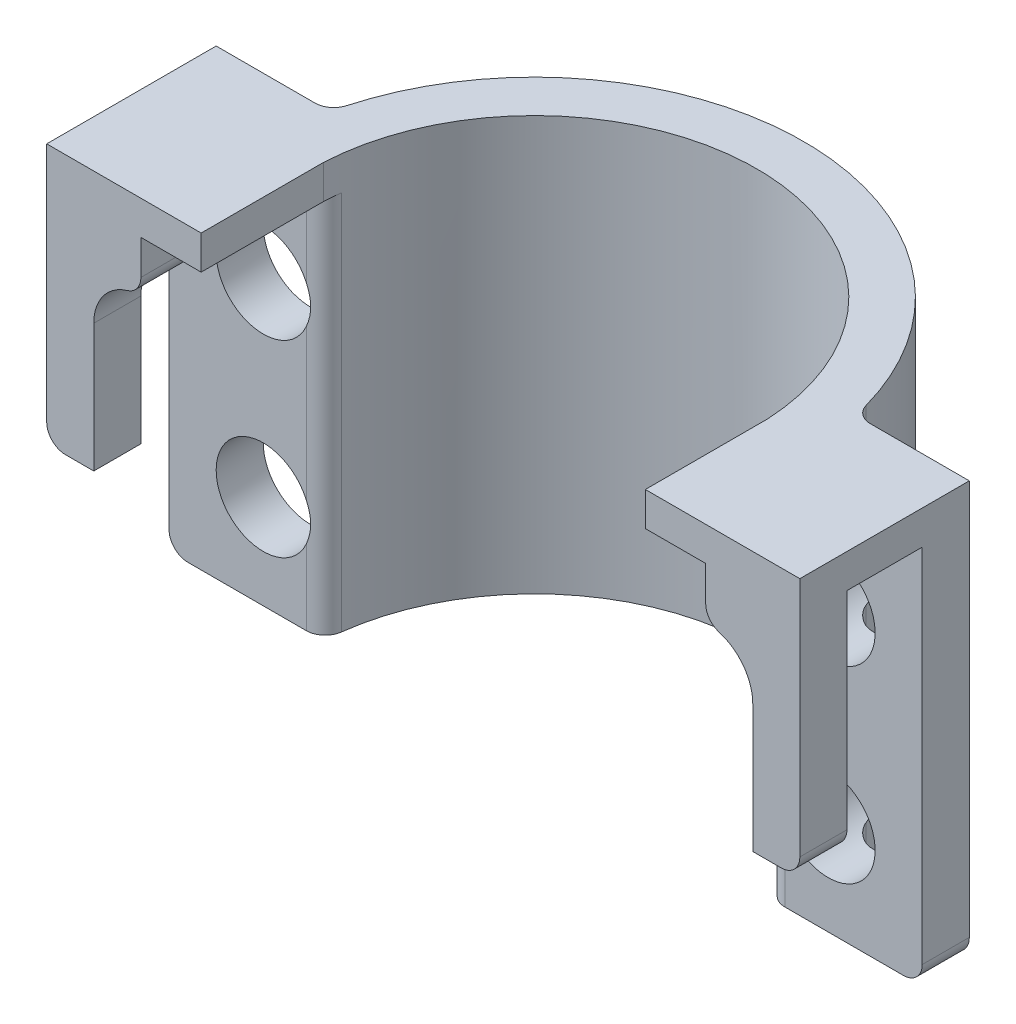
from build123d import *
from OCP.BRepAlgoAPI import BRepAlgoAPI_Cut
from OCP.TopTools import TopTools_ListOfShape

# Parameters (mm, degrees)
BOSS_EXTRUDE1_DEPTH = 27.94
SKETCH3_R           = 3.175
CUT_EXTRUDE1_DEPTH  = 53.100399864
BOSS_EXTRUDE2_START = -10.419367
BOSS_EXTRUDE2_DEPTH = 10.419367
CUT_EXTRUDE2_DEPTH  = 6.35
FILLET1_R           = 1.27


with BuildPart() as part:
    # Sketch2 → Boss-Extrude1 (new body)
    with BuildSketch(Plane(origin=(0, 0, 0), x_dir=(1, 0, 0), z_dir=(0, 1, 0))):
        with BuildLine():
            Line((0, 0), (-10.419367303, 0))
            Line((-10.419367303, 0), (-10.419367303, 3.175))
            Line((-10.419367303, 3.175), (-2.762835284, 3.175))
            ThreePointArc((-2.762835284, 3.175), (14.980632697, 17.413), (32.724100678, 3.175))
            Line((32.724100678, 3.175), (40.380632697, 3.175))
            Line((40.380632697, 3.175), (40.380632697, 0))
            Line((40.380632697, 0), (29.961265394, 0))
            ThreePointArc((29.961265394, 0), (14.980632697, 14.238), (0, 0))
        make_face()
    extrude(amount=-BOSS_EXTRUDE1_DEPTH)

    # Sketch3 → Cut-Extrude1 (cut, through all)
    with BuildSketch(Plane.XY):
        with Locations((-4.069367303, -8.89)):
            Circle(SKETCH3_R)
        with Locations((34.030632697, -8.89)):
            Circle(SKETCH3_R)
        with Locations((-4.069367303, -21.59)):
            Circle(SKETCH3_R)
        with Locations((34.030632697, -21.59)):
            Circle(SKETCH3_R)
    extrude(amount=-CUT_EXTRUDE1_DEPTH, mode=Mode.SUBTRACT)

    # Sketch4 → Boss-Extrude2 (add)
    with BuildSketch(Plane(origin=(40.380632697, 0, 0), x_dir=(0, 0, -1), z_dir=(1, 0, 0)).offset(BOSS_EXTRUDE2_START)):
        Polygon((-5.08, -17.526), (-8.255, -17.526), (-8.255, 0), (0, 0), (0, -2.286), (-5.08, -2.286), align=None)
    boss_extrude2 = extrude(amount=BOSS_EXTRUDE2_DEPTH)


with BuildPart() as cut_extrude2_tool:
    # Sketch5 → Cut-Extrude2 (new body)
    with BuildSketch(Plane.XY.offset(8.255)):
        with BuildLine():
            Line((37.205632697, -8.89), (37.205632697, -17.526))
            Line((37.205632697, -17.526), (29.961265394, -17.526))
            Line((29.961265394, -17.526), (29.961265394, -2.286))
            Line((29.961265394, -2.286), (34.030632697, -2.286))
            Line((34.030632697, -2.286), (34.030632697, -5.715))
            ThreePointArc((34.030632697, -5.715), (36.275696727, -6.64493597), (37.205632697, -8.89))
        make_face()
    cut_extrude2 = extrude(amount=-CUT_EXTRUDE2_DEPTH)


with BuildPart() as part_1:
    add(part.part)

    # Cut-Extrude2: cut by cut_extrude2_tool, with a tolerance
    cut_extrude2_stock = TopTools_ListOfShape()
    cut_extrude2_stock.Append(part_1.part.wrapped)
    cut_extrude2_tools = TopTools_ListOfShape()
    cut_extrude2_tools.Append(cut_extrude2_tool.part.wrapped)
    cut_extrude2_cut = BRepAlgoAPI_Cut()
    cut_extrude2_cut.SetArguments(cut_extrude2_stock)
    cut_extrude2_cut.SetTools(cut_extrude2_tools)
    cut_extrude2_cut.SetFuzzyValue(0.00001)
    cut_extrude2_cut.Build()
    add(Compound.cast(cut_extrude2_cut.Shape()).solids(), mode=Mode.REPLACE)

    # Mirror1: Boss-Extrude2, Cut-Extrude2 across plane
    add(boss_extrude2.mirror(Plane.ZY.offset(-14.980632697)))
    add(cut_extrude2.mirror(Plane.ZY.offset(-14.980632697)), mode=Mode.SUBTRACT)

    # Fillet1
    # the kernel refuses this fillet: 1.27 mm, written as the material it adds along each edge
    with BuildSketch(Plane(origin=(32.724100678, 0, -3.175), x_dir=(1, 0, 0), z_dir=(0, -1, 0))) as fillet1_piece_1_section:
        with BuildLine():
            CenterArc((0.991397271, -1.27), FILLET1_R, 90, 74.467738735)
            ThreePointArc((-0.232222111, -0.929918231), (-0.109979978, -0.466490187), (0, 0))
            Line((0, 0), (0.991397271, 0))
        make_face()
    fillet1_piece_1 = extrude(amount=8.474776002, mode=Mode.PRIVATE)
    fillet1_piece_1 = fillet1_piece_1 - Plane(origin=(34.030632697, -8.89, -3.175), x_dir=(1, 0, 0), z_dir=(0, 0, 1)) * Cylinder(3.175, 21, mode=Mode.PRIVATE)
    add(fillet1_piece_1)
    with BuildSketch(Plane(origin=(32.724100678, -22.005223998, -3.175), x_dir=(1, 0, 0), z_dir=(0, -1, 0))) as fillet1_piece_2_section:
        with BuildLine():
            CenterArc((0.991397271, -1.27), FILLET1_R, 90, 74.467738735)
            ThreePointArc((-0.232222111, -0.929918231), (-0.109979978, -0.466490187), (0, 0))
            Line((0, 0), (0.991397271, 0))
        make_face()
    fillet1_piece_2 = extrude(amount=5.934776002, mode=Mode.PRIVATE)
    fillet1_piece_2 = fillet1_piece_2 - Plane(origin=(34.030632697, -21.59, -3.175), x_dir=(1, 0, 0), z_dir=(0, 0, 1)) * Cylinder(3.175, 16, mode=Mode.PRIVATE)
    add(fillet1_piece_2)
    with BuildSketch(Plane(origin=(32.724100678, -9.305223998, -3.175), x_dir=(1, 0, 0), z_dir=(0, -1, 0))) as fillet1_piece_3_section:
        with BuildLine():
            CenterArc((0.991397271, -1.27), FILLET1_R, 90, 74.467738735)
            ThreePointArc((-0.232222111, -0.929918231), (-0.109979978, -0.466490187), (0, 0))
            Line((0, 0), (0.991397271, 0))
        make_face()
    fillet1_piece_3 = extrude(amount=11.869552004, mode=Mode.PRIVATE)
    fillet1_piece_3 = fillet1_piece_3 - Plane(origin=(34.030632697, -21.59, -3.175), x_dir=(1, 0, 0), z_dir=(0, 0, 1)) * Cylinder(3.175, 28, mode=Mode.PRIVATE)
    fillet1_piece_3 = fillet1_piece_3 - Plane(origin=(34.030632697, -8.89, -3.175), x_dir=(1, 0, 0), z_dir=(0, 0, 1)) * Cylinder(3.175, 28, mode=Mode.PRIVATE)
    add(fillet1_piece_3)
    with BuildSketch(Plane(origin=(-2.762835284, 0, -3.175), x_dir=(0.24228281636804117, 0, -0.9702056673163532), z_dir=(0, -1, 0))) as fillet1_piece_4_section:
        with BuildLine():
            CenterArc((0.991962675, -1.269558427), FILLET1_R, 91.510947972, 74.467738735)
            Line((-0.240198523, -0.96185925), (0, 0))
            ThreePointArc((0, 0), (0.479237682, -0.006319359), (0.958475365, 0))
        make_face()
    fillet1_piece_4 = extrude(amount=8.474776002, mode=Mode.PRIVATE)
    fillet1_piece_4 = fillet1_piece_4 - Plane(origin=(-4.069367303, -8.89, -3.175), x_dir=(1, 0, 0), z_dir=(0, 0, 1)) * Cylinder(3.175, 21, mode=Mode.PRIVATE)
    add(fillet1_piece_4)
    with BuildSketch(Plane(origin=(-2.762835284, -22.005223998, -3.175), x_dir=(0.24228281636804117, 0, -0.9702056673163532), z_dir=(0, -1, 0))) as fillet1_piece_5_section:
        with BuildLine():
            CenterArc((0.991962675, -1.269558427), FILLET1_R, 91.510947972, 74.467738735)
            Line((-0.240198523, -0.96185925), (0, 0))
            ThreePointArc((0, 0), (0.479237682, -0.006319359), (0.958475365, 0))
        make_face()
    fillet1_piece_5 = extrude(amount=5.934776002, mode=Mode.PRIVATE)
    fillet1_piece_5 = fillet1_piece_5 - Plane(origin=(-4.069367303, -21.59, -3.175), x_dir=(1, 0, 0), z_dir=(0, 0, 1)) * Cylinder(3.175, 16, mode=Mode.PRIVATE)
    add(fillet1_piece_5)
    with BuildSketch(Plane(origin=(-2.762835284, -9.305223998, -3.175), x_dir=(0.24228281636804117, 0, -0.9702056673163532), z_dir=(0, -1, 0))) as fillet1_piece_6_section:
        with BuildLine():
            CenterArc((0.991962675, -1.269558427), FILLET1_R, 91.510947972, 74.467738735)
            Line((-0.240198523, -0.96185925), (0, 0))
            ThreePointArc((0, 0), (0.479237682, -0.006319359), (0.958475365, 0))
        make_face()
    fillet1_piece_6 = extrude(amount=11.869552004, mode=Mode.PRIVATE)
    fillet1_piece_6 = fillet1_piece_6 - Plane(origin=(-4.069367303, -21.59, -3.175), x_dir=(1, 0, 0), z_dir=(0, 0, 1)) * Cylinder(3.175, 28, mode=Mode.PRIVATE)
    fillet1_piece_6 = fillet1_piece_6 - Plane(origin=(-4.069367303, -8.89, -3.175), x_dir=(1, 0, 0), z_dir=(0, 0, 1)) * Cylinder(3.175, 28, mode=Mode.PRIVATE)
    add(fillet1_piece_6)
    # the kernel refuses this fillet: 1.27 mm, written as the material it takes off along each edge
    with BuildSketch(Plane(origin=(29.961265394, 2.904944682, 0), x_dir=(-0.08790703364756058, 0, -0.9961286831706467), z_dir=(0, -1, 0))) as fillet1_2_piece_1_section:
        with BuildLine():
            CenterArc((1.1629374, 1.269121421), FILLET1_R, 185.043211655, 82.825455624)
            Line((-0.102146028, 1.157479488), (0, 0))
            ThreePointArc((0, 0), (0.557852926, 0.010376919), (1.115705852, 0))
        make_face()
    fillet1_2_piece_1 = extrude(amount=33.749889363, mode=Mode.PRIVATE)
    fillet1_2_piece_1 = split(fillet1_2_piece_1, bisect_by=Plane(origin=(29.961265394, -2.286, 0), z_dir=(0, -1, 0)), keep=Keep.TOP, mode=Mode.PRIVATE)
    add(fillet1_2_piece_1, mode=Mode.SUBTRACT)
    with BuildSketch(Plane(origin=(0, 2.904944682, 0), x_dir=(-1, 0, 0), z_dir=(0, -1, 0))) as fillet1_2_piece_2_section:
        with BuildLine():
            CenterArc((1.161977873, 1.27), FILLET1_R, 187.174544376, 82.825455624)
            ThreePointArc((-0.098078392, 1.111386601), (-0.038702449, 0.556605505), (0, 0))
            Line((0, 0), (1.161977873, 0))
        make_face()
    fillet1_2_piece_2 = extrude(amount=33.749889363, mode=Mode.PRIVATE)
    fillet1_2_piece_2 = split(fillet1_2_piece_2, bisect_by=Plane(origin=(0, -2.286, 0), z_dir=(0, -1, 0)), keep=Keep.TOP, mode=Mode.PRIVATE)
    add(fillet1_2_piece_2, mode=Mode.SUBTRACT)
    with BuildSketch(Plane(origin=(-10.419367303, -17.526, 1.905), x_dir=(0, 1, 0), z_dir=(0, 0, 1)), Plane(origin=(40.380632697, -27.94, -6.35), x_dir=(-1, 0, 0), z_dir=(0, 0, 1)), Plane(origin=(40.380632697, -17.526, 1.905), x_dir=(-1, 0, 0), z_dir=(0, 0, 1))) as fillet1_2_piece_3:
        with BuildLine():
            CenterArc((FILLET1_R, -FILLET1_R), FILLET1_R, 90, 90)
            Line((0, -FILLET1_R), (0, 0))
            Line((0, 0), (FILLET1_R, 0))
        make_face()
    extrude(amount=9.525, mode=Mode.SUBTRACT)
    with BuildSketch(Plane(origin=(-10.419367303, -27.94, 3.175), x_dir=(0, 1, 0), z_dir=(0, 0, -1))) as fillet1_2_piece_4:
        with BuildLine():
            CenterArc((FILLET1_R, FILLET1_R), FILLET1_R, 180, 90)
            Line((0, FILLET1_R), (0, 0))
            Line((0, 0), (FILLET1_R, 0))
        make_face()
    extrude(amount=9.525, mode=Mode.SUBTRACT)
    with BuildSketch(Plane(origin=(34.030632697, -5.715, 10.966773743), x_dir=(0, 1, 0), z_dir=(0, 0, -1))) as fillet1_2_piece_5:
        with BuildLine():
            CenterArc((1.084709497, 1.27), FILLET1_R, 196.601549599, 73.398450401)
            ThreePointArc((-0.132350359, 0.907142857), (-0.033261818, 0.458373423), (0, 0))
            Line((0, 0), (1.084709497, 0))
        make_face()
    extrude(amount=8.598547486, mode=Mode.SUBTRACT)
    with BuildSketch(Plane(origin=(-4.069367303, -5.715, 10.966773743), x_dir=(0, 1, 0), z_dir=(0, 0, -1))) as fillet1_2_piece_6:
        with BuildLine():
            CenterArc((1.084709497, -1.27), FILLET1_R, 90, 73.398450401)
            ThreePointArc((-0.132350359, -0.907142857), (-0.033261818, -0.458373423), (0, 0))
            Line((0, 0), (1.084709497, 0))
        make_face()
    extrude(amount=8.598547486, mode=Mode.SUBTRACT)


solid = part_1.part
